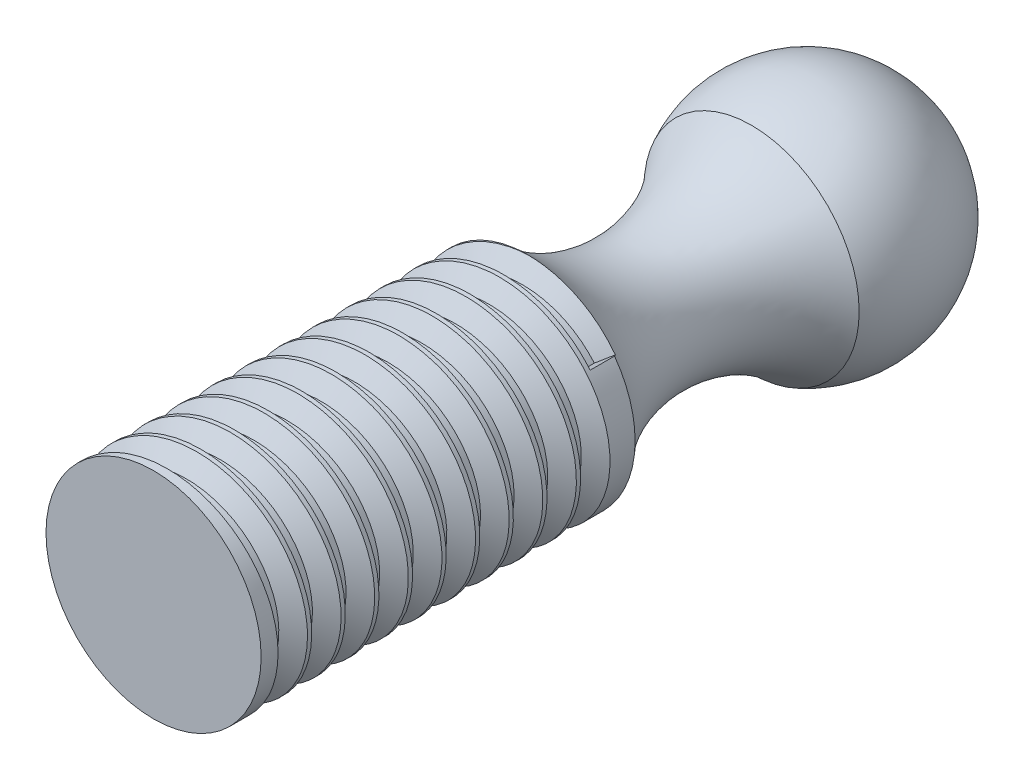
from build123d import *

# Parameters (mm, degrees)
SCHIZZO3_R                   = 4
ESTRUSIONE_ESTRUSIONE1_DEPTH = 24.3
FILETTATURA1_PITCH           = 1.25


with BuildPart() as part:
    # Schizzo2 → Rivoluzione1 (revolve)
    with BuildSketch(Plane.XY):
        with BuildLine():
            Line((13.397999688, -1.354593188), (22.397999688, -1.354593188))
            ThreePointArc((22.397999688, -1.354593188), (17.897999688, 3.145406812), (13.397999688, -1.354593188))
        make_face()
    revolve(axis=Axis((13.397999688, -1.354593188, 0), (1, 0, 0)))

    # Schizzo3 → Estrusione-Estrusione1 (add)
    with BuildSketch(Plane.XY):
        with Locations(Location((17.897999688, -1.354593188, 0), (0, 0, 180))):
            Circle(SCHIZZO3_R)
    extrude(amount=ESTRUSIONE_ESTRUSIONE1_DEPTH)

    # Filettatura1: the profile of Profilo filettatura1 profile screwed along a right-hand helix of 10.4 turns, 8 arcs to a turn; built about Z, then put on its axis
    filettatura1_z = Axis((0, 0, 0), (0, 0, 1))
    filettatura1_corners = [(4.0003, 0, -0.000173205), (4.0003, 0, 1.093923202), (3.323417656, 0, 0.703124998), (3.323417656, 0, 0.390624998)]
    with BuildLine(mode=Mode.PRIVATE) as filettatura1_profile:
        Line(filettatura1_corners[0], filettatura1_corners[1])
        Line(filettatura1_corners[1], filettatura1_corners[2])
        Line(filettatura1_corners[2], filettatura1_corners[3])
        Line(filettatura1_corners[3], filettatura1_corners[0])
    filettatura1_cap = Face(filettatura1_profile.wire())
    filettatura1_turn_angles = [0, 22.5, 45, 67.5, 90, 112.5, 135, 157.5, 180, 202.5, 225, 247.5, 270, 292.5, 315, 337.5, 360]
    filettatura1_turn_weights = [1, 0.9238795325112867, 1, 0.9238795325112867, 1, 0.9238795325112867, 1, 0.9238795325112867, 1, 0.9238795325112867, 1, 0.9238795325112867, 1, 0.9238795325112867, 1, 0.9238795325112867, 1]
    filettatura1_turn_rails = [Edge.make_bspline([Vector(p[0], p[1], 0).rotate(filettatura1_z, filettatura1_turn_angles[k]) / filettatura1_turn_weights[k] + Vector(0, 0, p[2] + FILETTATURA1_PITCH * filettatura1_turn_angles[k] / 360) for k in range(17)], [0, 0, 0, 1, 1, 2, 2, 3, 3, 4, 4, 5, 5, 6, 6, 7, 7, 8, 8, 8], 2, filettatura1_turn_weights) for p in filettatura1_corners]
    filettatura1_turn_sides = [Face.make_surface_from_curves(filettatura1_turn_rails[p[0]], filettatura1_turn_rails[p[1]]) for p in [(0, 1), (1, 2), (2, 3), (3, 0)]]
    filettatura1_last_angles = [3600, 3622.5, 3645, 3667.5, 3690, 3712.5, 3735, 3739.5, 3744]
    filettatura1_last_weights = [1, 0.9238795325112867, 1, 0.9238795325112867, 1, 0.9238795325112867, 1, 0.996917333733128, 1]
    filettatura1_last_rails = [Edge.make_bspline([Vector(p[0], p[1], 0).rotate(filettatura1_z, filettatura1_last_angles[k]) / filettatura1_last_weights[k] + Vector(0, 0, p[2] + FILETTATURA1_PITCH * filettatura1_last_angles[k] / 360) for k in range(9)], [0, 0, 0, 1, 1, 2, 2, 3, 3, 4, 4, 4], 2, filettatura1_last_weights) for p in filettatura1_corners]
    filettatura1_last_sides = [Face.make_surface_from_curves(filettatura1_last_rails[p[0]], filettatura1_last_rails[p[1]]) for p in [(0, 1), (1, 2), (2, 3), (3, 0)]]
    filettatura1 = Plane(origin=(17.897999688, -1.354593188, 24.3), x_dir=(-1, 0, 0), z_dir=(0, 0, -1)) * Solid(Shell([*[p.moved(Location((0, 0, FILETTATURA1_PITCH * i))) for i in range(10) for p in filettatura1_turn_sides], *filettatura1_last_sides, filettatura1_cap, filettatura1_cap.rotate(filettatura1_z, 3744).moved(Location((0, 0, FILETTATURA1_PITCH * 3744 / 360)))]))
    add(filettatura1, mode=Mode.SUBTRACT)

    # Schizzo6 → Taglia-Rivoluzione4 (revolve, cut)
    with BuildSketch(Plane(origin=(17.897999688, 0, 0), x_dir=(0, 0, -1), z_dir=(1, 0, 0)), mode=Mode.PRIVATE) as taglia_rivoluzione4_sk:
        with BuildLine():
            Line((-2.061552813, 2.645406812), (-10.393750003, 2.645406812))
            ThreePointArc((-10.393750003, 2.645406812), (-6.227651408, 0.963232943), (-2.061552813, 2.645406812))
        make_face()
    revolve(taglia_rivoluzione4_sk.sketch.rotate(Axis((17.897999688, -1.354593188, 24.299975), (0, 0, -1)), 90), axis=Axis((17.897999688, -1.354593188, 24.299975), (0, 0, -1)), mode=Mode.SUBTRACT)


solid = part.part
